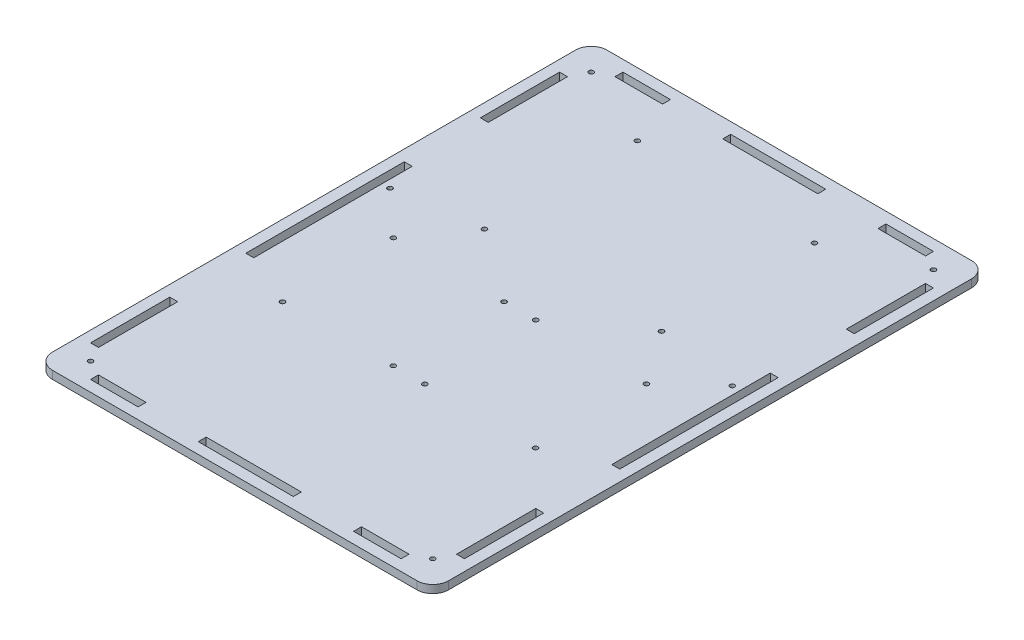
from build123d import *

# Parameters (mm, degrees)
SKETCH1_R           = 1.5
SKETCH1_W           = 30
SKETCH1_H           = 5
SKETCH1_W_2         = 5
SKETCH1_H_2         = 50
SKETCH1_W_3         = 60
SKETCH1_H_3         = 100
BOSS_EXTRUDE1_DEPTH = 5


with BuildPart() as part:
    # Sketch1 → Boss-Extrude1 (new body)
    # profile 1 of 2: a face of its own
    with BuildSketch(Plane(origin=(0, 0, 0), x_dir=(1, 0, 0), z_dir=(0, 1, 0))):
        with BuildLine():
            ThreePointArc((0, 10), (2.928932188, 2.928932188), (10, 0))
            Line((10, 0), (240, 0))
            ThreePointArc((240, 0), (247.071067812, 2.928932188), (250, 10))
            Line((250, 10), (250, 340))
            ThreePointArc((250, 340), (247.071067812, 347.071067812), (240, 350))
            Line((240, 350), (10, 350))
            ThreePointArc((10, 350), (2.928932188, 347.071067812), (0, 340))
            Line((0, 340), (0, 10))
        make_face()
        with Locations((17, 17)):
            Circle(SKETCH1_R, mode=Mode.SUBTRACT)
        with Locations((42, 9.5)):
            Rectangle(SKETCH1_W, SKETCH1_H, mode=Mode.SUBTRACT)
        with Locations((9.5, 52)):
            Rectangle(SKETCH1_W_2, SKETCH1_H_2, mode=Mode.SUBTRACT)
        with Locations((45.15, 110)):
            Circle(SKETCH1_R, mode=Mode.SUBTRACT)
        with Locations((115, 110)):
            Circle(SKETCH1_R, mode=Mode.SUBTRACT)
        with Locations((125, 9.5)):
            Rectangle(SKETCH1_W_3, SKETCH1_H, mode=Mode.SUBTRACT)
        with Locations((208, 9.5)):
            Rectangle(SKETCH1_W, SKETCH1_H, mode=Mode.SUBTRACT)
        with Locations((233, 17)):
            Circle(SKETCH1_R, mode=Mode.SUBTRACT)
        with Locations((240.5, 52)):
            Rectangle(SKETCH1_W_2, SKETCH1_H_2, mode=Mode.SUBTRACT)
        with Locations((135, 110)):
            Circle(SKETCH1_R, mode=Mode.SUBTRACT)
        with Locations((204.85, 110)):
            Circle(SKETCH1_R, mode=Mode.SUBTRACT)
        Polygon((7, 175), (7, 225), (12, 225), (12, 125), (7, 125), align=None, mode=Mode.SUBTRACT)
        with Locations((17, 206)):
            Circle(SKETCH1_R, mode=Mode.SUBTRACT)
        with Locations((45.15, 179.98)):
            Circle(SKETCH1_R, mode=Mode.SUBTRACT)
        with Locations((69.12, 213.48)):
            Circle(SKETCH1_R, mode=Mode.SUBTRACT)
        with Locations((115, 179.98)):
            Circle(SKETCH1_R, mode=Mode.SUBTRACT)
        with Locations((9.5, 298)):
            Rectangle(SKETCH1_W_2, SKETCH1_H_2, mode=Mode.SUBTRACT)
        with Locations((17, 333)):
            Circle(SKETCH1_R, mode=Mode.SUBTRACT)
        with Locations((42, 340.5)):
            Rectangle(SKETCH1_W, SKETCH1_H, mode=Mode.SUBTRACT)
        with Locations((69.12, 310)):
            Circle(SKETCH1_R, mode=Mode.SUBTRACT)
        with Locations((135, 179.98)):
            Circle(SKETCH1_R, mode=Mode.SUBTRACT)
        with Locations((180.88, 213.48)):
            Circle(SKETCH1_R, mode=Mode.SUBTRACT)
        with Locations((204.85, 179.98)):
            Circle(SKETCH1_R, mode=Mode.SUBTRACT)
        with Locations((240.5, 175)):
            Rectangle(SKETCH1_W_2, SKETCH1_H_3, mode=Mode.SUBTRACT)
        with Locations((233, 206)):
            Circle(SKETCH1_R, mode=Mode.SUBTRACT)
        Polygon((95, 343), (125, 343), (155, 343), (155, 338), (95, 338), align=None, mode=Mode.SUBTRACT)
        with Locations((180.88, 310)):
            Circle(SKETCH1_R, mode=Mode.SUBTRACT)
        with Locations((240.5, 298)):
            Rectangle(SKETCH1_W_2, SKETCH1_H_2, mode=Mode.SUBTRACT)
        with Locations((208, 340.5)):
            Rectangle(SKETCH1_W, SKETCH1_H, mode=Mode.SUBTRACT)
        with Locations((233, 333)):
            Circle(SKETCH1_R, mode=Mode.SUBTRACT)
    # profile 2 of 2: a face of its own
    with BuildSketch(Plane(origin=(0, 0, 0), x_dir=(1, 0, 0), z_dir=(0, 1, 0))):
        with BuildLine():
            ThreePointArc((0, 10), (2.928932188, 2.928932188), (10, 0))
            Line((10, 0), (240, 0))
            ThreePointArc((240, 0), (247.071067812, 2.928932188), (250, 10))
            Line((250, 10), (250, 340))
            ThreePointArc((250, 340), (247.071067812, 347.071067812), (240, 350))
            Line((240, 350), (10, 350))
            ThreePointArc((10, 350), (2.928932188, 347.071067812), (0, 340))
            Line((0, 340), (0, 10))
        make_face()
        with Locations((17, 17)):
            Circle(SKETCH1_R, mode=Mode.SUBTRACT)
        with Locations((42, 9.5)):
            Rectangle(SKETCH1_W, SKETCH1_H, mode=Mode.SUBTRACT)
        with Locations((9.5, 52)):
            Rectangle(SKETCH1_W_2, SKETCH1_H_2, mode=Mode.SUBTRACT)
        with Locations((45.15, 110)):
            Circle(SKETCH1_R, mode=Mode.SUBTRACT)
        with Locations((115, 110)):
            Circle(SKETCH1_R, mode=Mode.SUBTRACT)
        with Locations((125, 9.5)):
            Rectangle(SKETCH1_W_3, SKETCH1_H, mode=Mode.SUBTRACT)
        with Locations((208, 9.5)):
            Rectangle(SKETCH1_W, SKETCH1_H, mode=Mode.SUBTRACT)
        with Locations((233, 17)):
            Circle(SKETCH1_R, mode=Mode.SUBTRACT)
        with Locations((240.5, 52)):
            Rectangle(SKETCH1_W_2, SKETCH1_H_2, mode=Mode.SUBTRACT)
        with Locations((135, 110)):
            Circle(SKETCH1_R, mode=Mode.SUBTRACT)
        with Locations((204.85, 110)):
            Circle(SKETCH1_R, mode=Mode.SUBTRACT)
        Polygon((7, 175), (7, 225), (12, 225), (12, 125), (7, 125), align=None, mode=Mode.SUBTRACT)
        with Locations((17, 206)):
            Circle(SKETCH1_R, mode=Mode.SUBTRACT)
        with Locations((45.15, 179.98)):
            Circle(SKETCH1_R, mode=Mode.SUBTRACT)
        with Locations((69.12, 213.48)):
            Circle(SKETCH1_R, mode=Mode.SUBTRACT)
        with Locations((115, 179.98)):
            Circle(SKETCH1_R, mode=Mode.SUBTRACT)
        with Locations((9.5, 298)):
            Rectangle(SKETCH1_W_2, SKETCH1_H_2, mode=Mode.SUBTRACT)
        with Locations((17, 333)):
            Circle(SKETCH1_R, mode=Mode.SUBTRACT)
        with Locations((42, 340.5)):
            Rectangle(SKETCH1_W, SKETCH1_H, mode=Mode.SUBTRACT)
        with Locations((69.12, 310)):
            Circle(SKETCH1_R, mode=Mode.SUBTRACT)
        with Locations((135, 179.98)):
            Circle(SKETCH1_R, mode=Mode.SUBTRACT)
        with Locations((180.88, 213.48)):
            Circle(SKETCH1_R, mode=Mode.SUBTRACT)
        with Locations((204.85, 179.98)):
            Circle(SKETCH1_R, mode=Mode.SUBTRACT)
        with Locations((240.5, 175)):
            Rectangle(SKETCH1_W_2, SKETCH1_H_3, mode=Mode.SUBTRACT)
        with Locations((233, 206)):
            Circle(SKETCH1_R, mode=Mode.SUBTRACT)
        Polygon((95, 343), (125, 343), (155, 343), (155, 338), (95, 338), align=None, mode=Mode.SUBTRACT)
        with Locations((180.88, 310)):
            Circle(SKETCH1_R, mode=Mode.SUBTRACT)
        with Locations((240.5, 298)):
            Rectangle(SKETCH1_W_2, SKETCH1_H_2, mode=Mode.SUBTRACT)
        with Locations((208, 340.5)):
            Rectangle(SKETCH1_W, SKETCH1_H, mode=Mode.SUBTRACT)
        with Locations((233, 333)):
            Circle(SKETCH1_R, mode=Mode.SUBTRACT)
    extrude(amount=BOSS_EXTRUDE1_DEPTH)


solid = part.part
